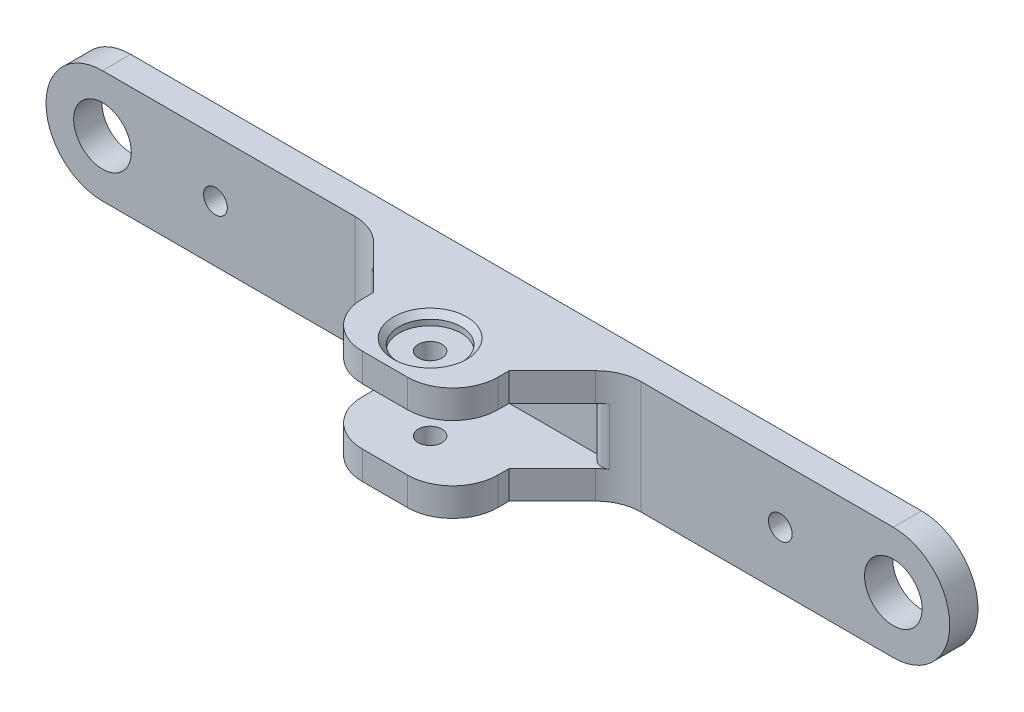
from build123d import *

# Parameters (mm, degrees)
BOSS_EXTRU_1_DEPTH      = 5
ESQUISSE2_R             = 5.1
ESQUISSE2_R_2           = 2.1
ENL_V_MAT_EXTRU_1_DEPTH = 81.777472107
ESQUISSE3_W             = 24
ESQUISSE3_H             = 20
BOSS_EXTRU_2_DEPTH      = 20
CHANFREIN1_SIZE         = 10
ESQUISSE4_W             = 36
ESQUISSE4_H             = 10
ENL_V_MAT_EXTRU_2_DEPTH = 20
ESQUISSE5_R             = 2.1
ENL_V_MAT_EXTRU_3_DEPTH = 87.168439698
CONG_1_R                = 8
ESQUISSE6_R             = 5.5
ENL_V_MAT_EXTRU_4_DEPTH = 2
CHANFREIN2_SIZE         = 1
CONG_4_R                = 2


with BuildPart() as part:
    # Esquisse1 → Boss.-Extru.1 (new body)
    with BuildSketch(Plane.XY):
        with BuildLine():
            Line((-70, 10), (70, 10))
            ThreePointArc((70, 10), (80, 0), (70, -10))
            Line((70, -10), (-70, -10))
            ThreePointArc((-70, -10), (-80, 0), (-70, 10))
        make_face()
    extrude(amount=BOSS_EXTRU_1_DEPTH)

    # Esquisse2 → Enlèv. mat.-Extru.1 (cut, through all)
    with BuildSketch(Plane.XY.offset(5)):
        with Locations((-70, 0)):
            Circle(ESQUISSE2_R)
        with Locations((70, 0)):
            Circle(ESQUISSE2_R)
        with Locations((-50, 0)):
            Circle(ESQUISSE2_R_2)
        with Locations((50, 0)):
            Circle(ESQUISSE2_R_2)
    extrude(amount=-ENL_V_MAT_EXTRU_1_DEPTH, mode=Mode.SUBTRACT)

    # Esquisse3 → Boss.-Extru.2 (add)
    with BuildSketch(Plane.XY.offset(5)):
        Rectangle(ESQUISSE3_W, ESQUISSE3_H)
    extrude(amount=BOSS_EXTRU_2_DEPTH)

    # Chanfrein1
    chanfrein1_edges = [part.edges().sort_by_distance(p)[0] for p in [
        (12, 0, 5),
        (-12, 0, 5),
    ]]
    chamfer(chanfrein1_edges, length=CHANFREIN1_SIZE)

    # Esquisse4 → Enlèv. mat.-Extru.2 (cut)
    with BuildSketch(Plane.XY.offset(25)):
        Rectangle(ESQUISSE4_W, ESQUISSE4_H)
    extrude(amount=-ENL_V_MAT_EXTRU_2_DEPTH, mode=Mode.SUBTRACT)

    # Esquisse5 → Enlèv. mat.-Extru.3 (cut, through all)
    with BuildSketch(Plane(origin=(0, 10, 0), x_dir=(1, 0, 0), z_dir=(0, 1, 0))):
        with Locations(Location((0, -17, 0), (0, 0, 270))):
            Circle(ESQUISSE5_R)
    extrude(amount=-ENL_V_MAT_EXTRU_3_DEPTH, mode=Mode.SUBTRACT)

    # Congé1
    cong_1_edges = [part.edges().sort_by_distance(p)[0] for p in [
        (-22, 0, 5),
        (-12, -7.5, 25),
        (12, -7.5, 25),
        (22, 0, 5),
        (-12, 7.5, 25),
        (12, 7.5, 25),
    ]]
    fillet(cong_1_edges, radius=CONG_1_R)

    # Esquisse6 → Enlèv. mat.-Extru.4 (cut)
    with BuildSketch(Plane(origin=(0, 10, 0), x_dir=(1, 0, 0), z_dir=(0, 1, 0))):
        with Locations(Location((0, -17, 0), (0, 0, 270))):
            Circle(ESQUISSE6_R)
    extrude(amount=-ENL_V_MAT_EXTRU_4_DEPTH, mode=Mode.SUBTRACT)

    # Chanfrein2
    chanfrein2_edges = [part.edges().sort_by_distance(p)[0] for p in [
        (0, 10, 11.5),
    ]]
    chamfer(chanfrein2_edges, length=CHANFREIN2_SIZE)

    # Congé4
    # the kernel refuses this fillet: 2 mm, written as the material it takes off along each edge
    with BuildSketch(Plane(origin=(18, -5, 9), x_dir=(0.7394878589424565, 0, -0.6731698942144558), z_dir=(0, 1, 0)), Plane(origin=(-18, 5, 9), x_dir=(-0.7394878589424565, 0, -0.6731698942144557), z_dir=(0, -1, 0))) as cong_4_piece_1:
        with BuildLine():
            CenterArc((4.431818389, 1.970329953), CONG_4_R, 150.40864019, 109.709922664)
            Line((2.692679577, 2.957951436), (2.518765696, 3.056713584))
            ThreePointArc((2.518765696, 3.056713584), (1.198442217, 1.613609697), (-0.147897572, 0.134633979))
            Line((-0.147897572, 0.134633979), (0.009378777, -0.199779975))
            ThreePointArc((0.009378777, -0.199779975), (2.349946778, -0.089900774), (4.054276537, -0.197032995))
            Line((4.054276537, -0.197032995), (4.088598523, 0))
        make_face()
    extrude(amount=10, mode=Mode.SUBTRACT)


solid = part.part
